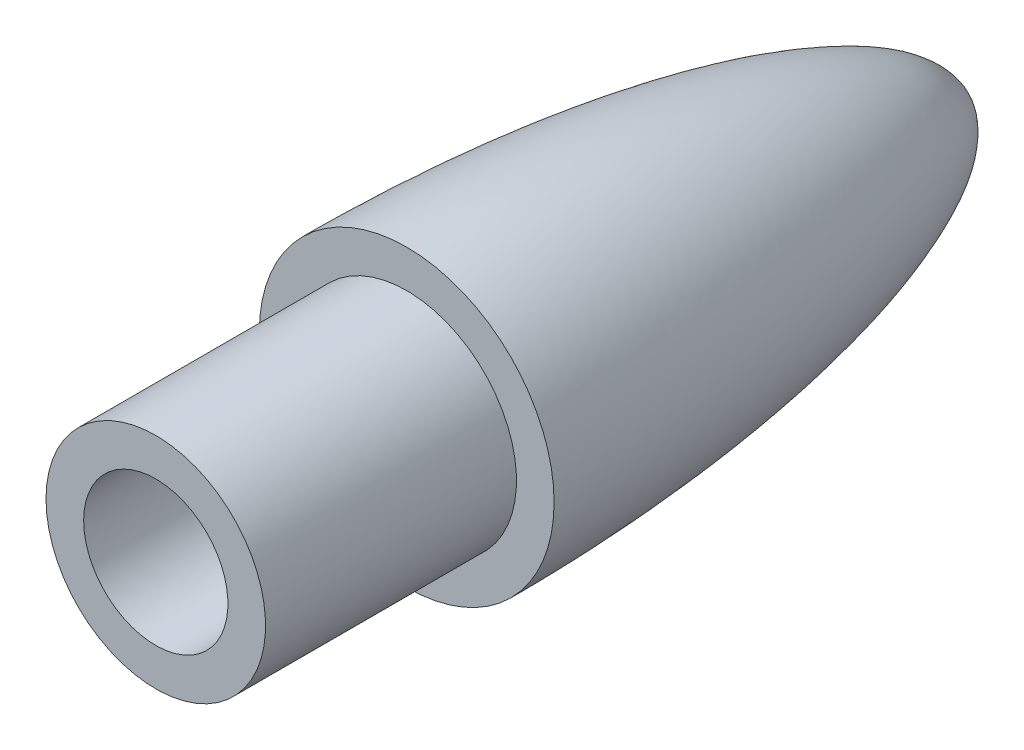
from build123d import *


with BuildPart() as part:
    # Sketch1 → Revolve1 (revolve)
    with BuildSketch(Plane(origin=(0, 0, 0), x_dir=(1, 0, 0), z_dir=(0, 1, 0))):
        with BuildLine():
            Line((0, 11.422413793), (0, 8.922413793))
            Line((0, 8.922413793), (-6.034260666, -1.943584812))
            Line((-6.034260666, -1.943584812), (-8.75, -29.577586207))
            Line((-8.75, -29.577586207), (-5.75, -29.577586207))
            Line((-5.75, -29.577586207), (-5.75, -52.577586207))
            Line((-5.75, -52.577586207), (-8.75, -52.577586207))
            Line((-8.75, -52.577586207), (-8.75, -32.577586207))
            Line((-8.75, -32.577586207), (-11.75, -32.577586207))
            add(Edge.make_bspline(
                [(0, 11.422413793), (-1.278423588, 11.417026245), (-3.873144244, 9.558695327), (-5.944786969, 5.627242402), (-7.710873625, 0.905910608), (-8.885618359, -3.570284013), (-9.891395845, -8.594561629), (-10.670483225, -13.791762741), (-11.219012774, -19.122009095), (-11.530237696, -23.790668903), (-11.707521388, -28.093294524), (-11.749966177, -30.922446964), (-11.75, -32.577586207)],
                knots=[0, 0, 0, 0, 0.077095745, 0.191082865, 0.27602247, 0.396033744, 0.482752955, 0.599802605, 0.727919369, 0.821235279, 0.895416594, 1, 1, 1, 1], degree=3))
        make_face()
    revolve(axis=Axis((0, 0, -11.422413793), (0, 0, 1)))


solid = part.part
